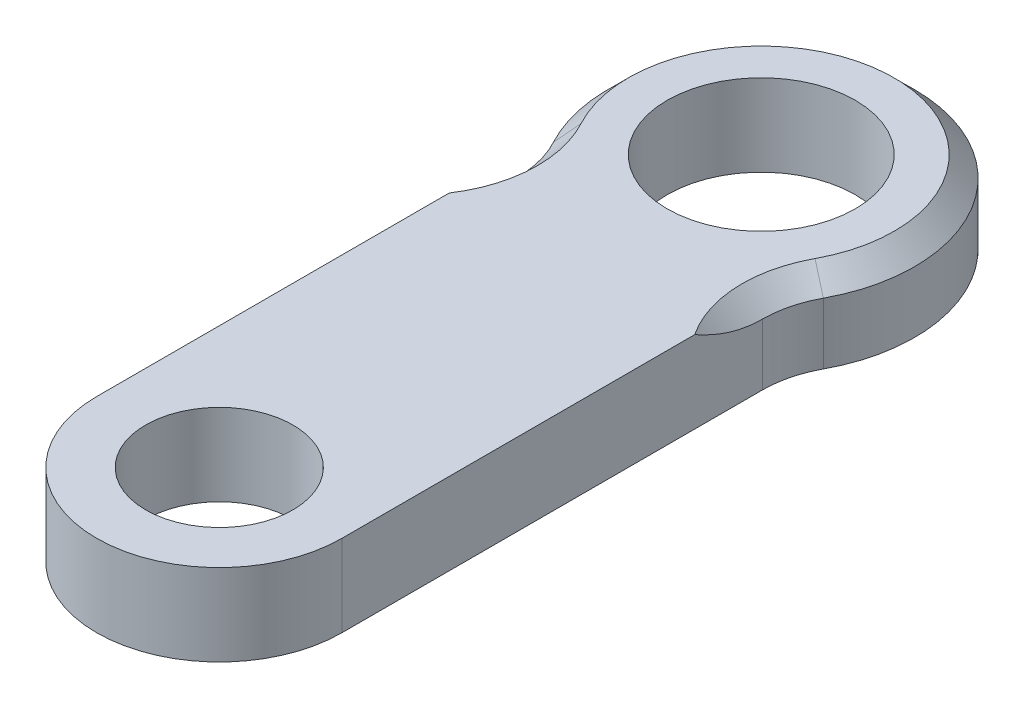
from build123d import *

# Parameters (mm, degrees)
SKETCH1_R           = 4.6
SKETCH1_R_2         = 3.6
BOSS_EXTRUDE1_DEPTH = 4
BOSS_EXTRUDE2_START = -4
SKETCH2_R           = 7.5
SKETCH2_R_2         = 4.6
BOSS_EXTRUDE2_DEPTH = 4
FILLET1_R           = 5


with BuildPart() as part:
    # Sketch1 → Boss-Extrude1 (new body)
    with BuildSketch(Plane(origin=(0, 0, 0), x_dir=(1, 0, 0), z_dir=(0, 1, 0))):
        with BuildLine():
            Line((6, 0), (6, -26.5))
            ThreePointArc((6, -26.5), (0, -32.5), (-6, -26.5))
            Line((-6, -26.5), (-6, 0))
            ThreePointArc((-6, 0), (0, 6), (6, 0))
        make_face()
        with Locations(Location((0, 0, 0), (0, 0, 270))):
            Circle(SKETCH1_R, mode=Mode.SUBTRACT)
        with Locations(Location((0, -26.5, 0), (0, 0, 270))):
            Circle(SKETCH1_R_2, mode=Mode.SUBTRACT)
    extrude(amount=BOSS_EXTRUDE1_DEPTH)

    # Sketch2 → Boss-Extrude2 (add)
    with BuildSketch(Plane(origin=(0, 4, 0), x_dir=(1, 0, 0), z_dir=(0, 1, 0)).offset(BOSS_EXTRUDE2_START)):
        Circle(SKETCH2_R)
        with Locations(Location((0, 0, 0), (0, 0, 270))):
            Circle(SKETCH2_R_2, mode=Mode.SUBTRACT)
    extrude(amount=BOSS_EXTRUDE2_DEPTH)

    # Fillet1
    fillet1_edges = [part.edges().sort_by_distance(p)[0] for p in [
        (6, 2, 4.5),
        (-6, 2, 4.5),
    ]]
    fillet(fillet1_edges, radius=FILLET1_R)

    # Chamfer2
    # the kernel refuses this chamfer: 1 mm, written as the material it takes off along each edge
    with BuildSketch(Plane(origin=(0, 4, 0), x_dir=(-0.8800000000000001, 0, 0.47497368348151653), z_dir=(0.47497368348151653, 0, 0.8800000000000001))) as chamfer2_piece_1:
        with BuildLine():
            Line((6.471715729, -0.028284271), (7.528284271, 1.028284271))
            Line((7.528284271, 1.028284271), (7.548284271, 1.028284271))
            ThreePointArc((7.548284271, 1.028284271), (7.52, 0.514142136), (7.52, 0))
            Line((7.52, 0), (7.5, -0.02))
            ThreePointArc((7.5, -0.02), (6.985857864, -0.02), (6.471715729, -0.048284271))
            Line((6.471715729, -0.048284271), (6.471715729, -0.028284271))
        make_face()
    revolve(axis=Axis((0, 4, 0), (0, -1, 0)), revolution_arc=236.715273153, mode=Mode.SUBTRACT)
    with BuildSketch(Plane(origin=(11, 4, 5.937171044), x_dir=(-0.33003370038362406, 0, 0.9439691502433181), z_dir=(0.9439691502433181, 0, 0.33003370038362406))) as chamfer2_piece_2:
        with BuildLine():
            Line((6.028284271, -0.028284271), (4.971715729, 1.028284271))
            Line((4.971715729, 1.028284271), (4.951715729, 1.028284271))
            ThreePointArc((4.951715729, 1.028284271), (4.98, 0.514142136), (4.98, 0))
            Line((4.98, 0), (5, -0.02))
            ThreePointArc((5, -0.02), (5.514142136, -0.02), (6.028284271, -0.048284271))
            Line((6.028284271, -0.048284271), (6.028284271, -0.028284271))
        make_face()
    revolve(axis=Axis((11, 4, 5.937171044), (0, -1, 0)), revolution_arc=99.086815597, mode=Mode.SUBTRACT)
    with BuildSketch(Plane(origin=(-11, 4, 5.937171044), x_dir=(0.3300337003836236, 0, 0.9439691502433183), z_dir=(-0.9439691502433183, 0, 0.3300337003836236))) as chamfer2_piece_3:
        with BuildLine():
            Line((4.971715729, -1.028284271), (6.028284271, 0.028284271))
            Line((6.028284271, 0.028284271), (6.028284271, 0.048284271))
            ThreePointArc((6.028284271, 0.048284271), (5.514142136, 0.02), (5, 0.02))
            Line((5, 0.02), (4.98, 0))
            ThreePointArc((4.98, 0), (4.98, -0.514142136), (4.951715729, -1.028284271))
            Line((4.951715729, -1.028284271), (4.971715729, -1.028284271))
        make_face()
    revolve(axis=Axis((-11, 4, 5.937171044), (0, 1, 0)), revolution_arc=99.086815597, mode=Mode.SUBTRACT)


solid = part.part
